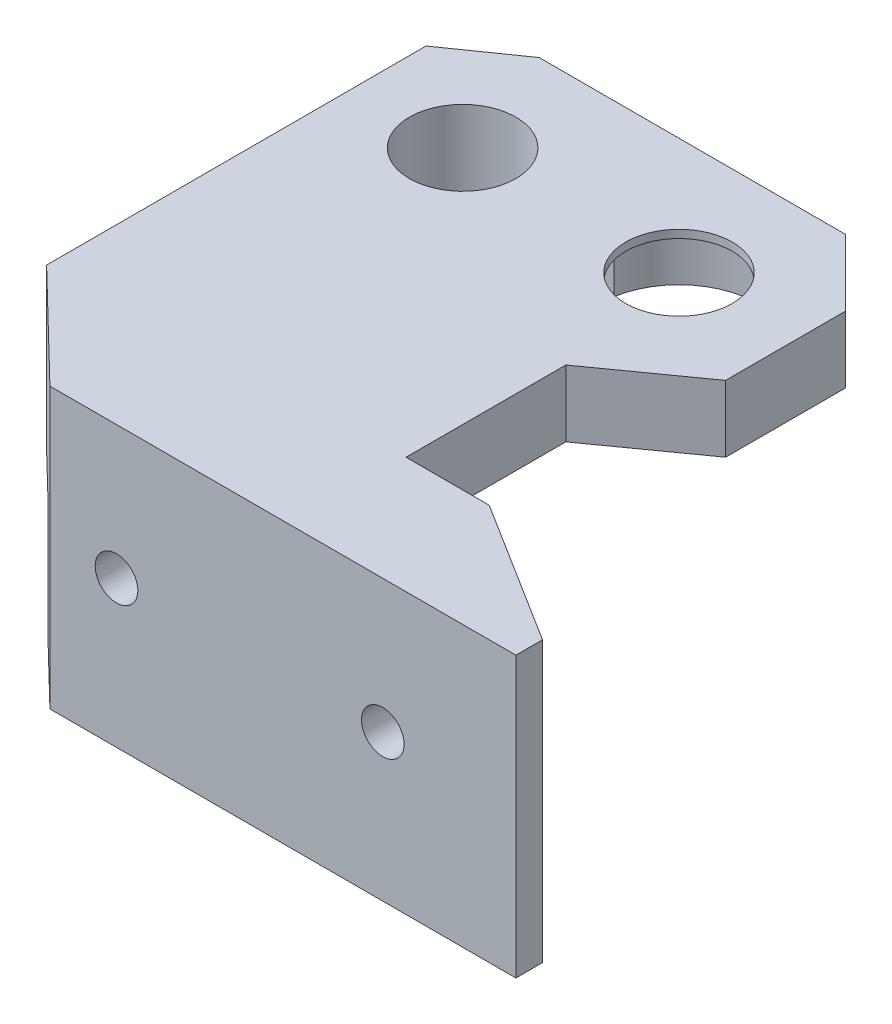
from build123d import *

# Parameters (mm, degrees)
SKETCH1_R           = 4
BOSS_EXTRUDE1_DEPTH = 5
BOSS_EXTRUDE2_DEPTH = 7
BOSS_EXTRUDE3_DEPTH = 16
BOSS_EXTRUDE4_START = 2.5
SKETCH6_R           = 7
SKETCH6_R_2         = 4
BOSS_EXTRUDE4_DEPTH = 2.5
CUT_EXTRUDE1_DEPTH  = 4.4
CUT_EXTRUDE2_DEPTH  = 45.33083013
SKETCH8_R           = 1.6
CUT_EXTRUDE3_DEPTH  = 50.235403928
SKETCH9_R           = 3
CUT_EXTRUDE4_DEPTH  = 4
SKETCH10_W          = 49.222079373
SKETCH10_H          = 39.75
CUT_EXTRUDE5_DEPTH  = 73.215389634


with BuildPart() as part:
    # Sketch1 → Boss-Extrude1 (new body)
    with BuildSketch(Plane(origin=(0, 0, 0), x_dir=(1, 0, 0), z_dir=(0, 1, 0))):
        Polygon((-3.75, 8.75), (19.25, 8.75), (24.25, 5.25), (24.25, -23.25), (16.25, -31), (-18.75, -31), (-18.75, -29), (-8, -22.25), (-1.75, -22.25), (-1.75, -10.25), (-8.75, -5.25), (-8.75, 3.75), align=None)
        Circle(SKETCH1_R, mode=Mode.SUBTRACT)
        with Locations((16.25, 0)):
            Circle(SKETCH1_R, mode=Mode.SUBTRACT)
    boss_extrude1 = extrude(amount=BOSS_EXTRUDE1_DEPTH)

    # Sketch2 → Boss-Extrude2 (add)
    with BuildSketch(Plane.XZ):
        Polygon((24.25, 23.25), (24.25, -5.25), (20.75, -5.25), (20.75, 22.25), (-8, 22.25), (-14.37037037, 26.25), (21.153225806, 26.25), align=None)
    boss_extrude2 = extrude(amount=BOSS_EXTRUDE2_DEPTH)

    # Sketch3 → Boss-Extrude3 (add)
    with BuildSketch(Plane.XZ):
        Polygon((-14.37037037, 26.25), (21.153225806, 26.25), (16.25, 31), (-18.75, 31), (-18.75, 29), align=None)
    boss_extrude3 = extrude(amount=BOSS_EXTRUDE3_DEPTH)

    # Sketch6 → Boss-Extrude4 (add)
    with BuildSketch(Plane.XZ.offset(BOSS_EXTRUDE4_START)):
        with Locations((16.25, 0)):
            Circle(SKETCH6_R)
        with Locations((16.25, 0)):
            Circle(SKETCH6_R_2, mode=Mode.SUBTRACT)
    boss_extrude4 = extrude(amount=-BOSS_EXTRUDE4_DEPTH)

    # Sketch4 → Cut-Extrude1 (cut)
    with BuildSketch(Plane.XZ):
        with BuildLine():
            Line((5.883782294, -1), (12.377016654, -1))
            ThreePointArc((12.377016654, -1), (12.25, 0), (12.377016654, 1))
            Line((12.377016654, 1), (5.883782294, 1))
            ThreePointArc((5.883782294, 1), (-5.968156673, 0), (5.883782294, -1))
        make_face()
    cut_extrude1 = extrude(amount=-CUT_EXTRUDE1_DEPTH, mode=Mode.SUBTRACT)

    # Sketch7 → Cut-Extrude2 (cut, through all)
    with BuildSketch(Plane.XZ.offset(-4.4)):
        with BuildLine():
            Line((5.883782294, -1), (12.377016654, -1))
            ThreePointArc((12.377016654, -1), (12.25, 0), (12.377016654, 1))
            Line((12.377016654, 1), (5.883782294, 1))
            ThreePointArc((5.883782294, 1), (-5.968156673, 0), (5.883782294, -1))
        make_face()
    cut_extrude2 = extrude(amount=CUT_EXTRUDE2_DEPTH, mode=Mode.SUBTRACT)

    # Sketch8 → Cut-Extrude3 (cut, through all)
    with BuildSketch(Plane.XY.offset(31)):
        with Locations((11.25, -5)):
            Circle(SKETCH8_R)
        with Locations((-8.75, -5)):
            Circle(SKETCH8_R)
    cut_extrude3 = extrude(amount=-CUT_EXTRUDE3_DEPTH, mode=Mode.SUBTRACT)

    # Sketch9 → Cut-Extrude4 (cut)
    with BuildSketch(Plane(origin=(0, 0, 22.25), x_dir=(-1, 0, 0), z_dir=(0, 0, -1))):
        with Locations((-11.25, -5)):
            Circle(SKETCH9_R)
        with Locations((8.75, -5)):
            Circle(SKETCH9_R)
    cut_extrude4 = extrude(amount=-CUT_EXTRUDE4_DEPTH, mode=Mode.SUBTRACT)

    # Mirror1: Boss-Extrude1, Boss-Extrude2, Boss-Extrude3, Boss-Extrude4, Cut-Extrude1, Cut-Extrude2, Cut-Extrude3, Cut-Extrude4 across plane
    add(boss_extrude1.mirror(Plane(origin=(-18.75, 5, 31), x_dir=(0, 0, 1), z_dir=(1, 0, 0))))
    add(boss_extrude2.mirror(Plane(origin=(-18.75, 5, 31), x_dir=(0, 0, 1), z_dir=(1, 0, 0))))
    add(boss_extrude3.mirror(Plane(origin=(-18.75, 5, 31), x_dir=(0, 0, 1), z_dir=(1, 0, 0))))
    add(boss_extrude4.mirror(Plane(origin=(-18.75, 5, 31), x_dir=(0, 0, 1), z_dir=(1, 0, 0))))
    add(cut_extrude1.mirror(Plane(origin=(-18.75, 5, 31), x_dir=(0, 0, 1), z_dir=(1, 0, 0))), mode=Mode.SUBTRACT)
    add(cut_extrude2.mirror(Plane(origin=(-18.75, 5, 31), x_dir=(0, 0, 1), z_dir=(1, 0, 0))), mode=Mode.SUBTRACT)
    add(cut_extrude3.mirror(Plane(origin=(-18.75, 5, 31), x_dir=(0, 0, 1), z_dir=(1, 0, 0))), mode=Mode.SUBTRACT)
    add(cut_extrude4.mirror(Plane(origin=(-18.75, 5, 31), x_dir=(0, 0, 1), z_dir=(1, 0, 0))), mode=Mode.SUBTRACT)

    # Sketch10 → Cut-Extrude5 (cut, through all)
    with BuildSketch(Plane(origin=(0, 5, 0), x_dir=(1, 0, 0), z_dir=(0, 1, 0))):
        with Locations((5.861039687, -11.125)):
            Rectangle(SKETCH10_W, SKETCH10_H)
    extrude(amount=-CUT_EXTRUDE5_DEPTH, mode=Mode.SUBTRACT)


solid = part.part
